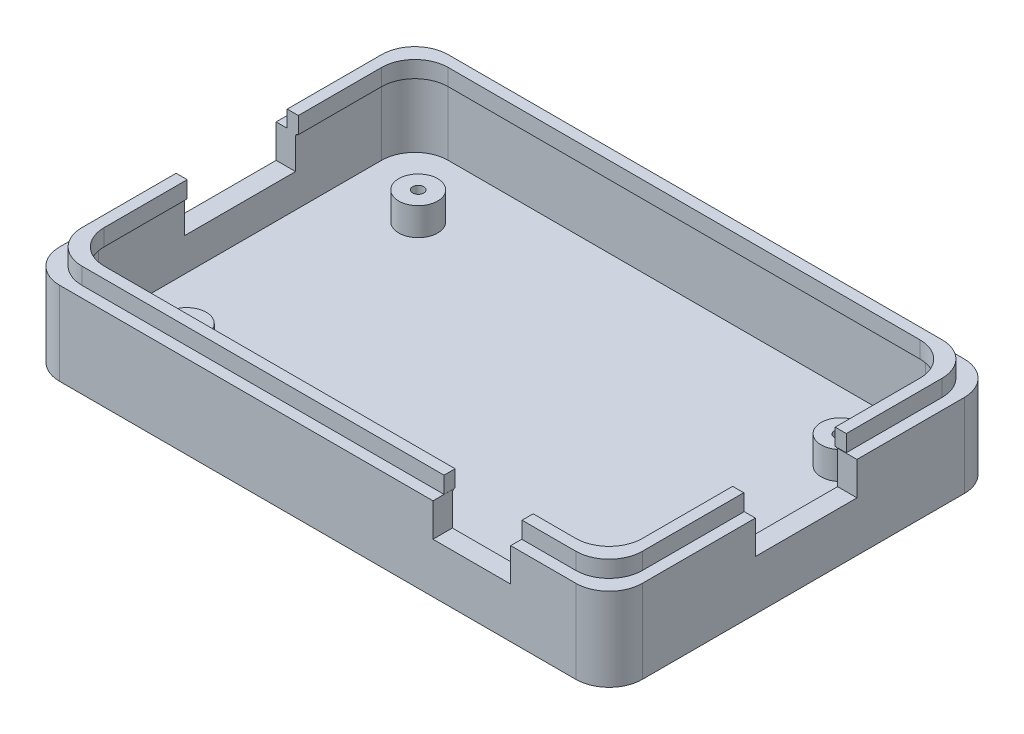
from build123d import *

# Parameters (mm, degrees)
SKETCH1_W           = 105
SKETCH1_H           = 70
BOSS_EXTRUDE1_DEPTH = 15
SKETCH3_W           = 98
SKETCH3_H           = 63
CUT_EXTRUDE1_DEPTH  = 12
FILLET1_R           = 6
SKETCH4_R           = 3.5
BOSS_EXTRUDE2_DEPTH = 5
SKETCH5_R           = 1
CUT_EXTRUDE2_DEPTH  = 8
SKETCH6_W           = 3.5
SKETCH6_H           = 18.3
SKETCH6_W_2         = 14
SKETCH6_H_2         = 3.5
SKETCH6_H_3         = 20
CUT_EXTRUDE3_DEPTH  = 6
BOSS_EXTRUDE3_DEPTH = 3
FILLET2_R           = 0.5


with BuildPart() as part:
    # Sketch1 → Boss-Extrude1 (new body)
    with BuildSketch(Plane(origin=(0, 0, 0), x_dir=(1, 0, 0), z_dir=(0, 1, 0))):
        Rectangle(SKETCH1_W, SKETCH1_H)
    extrude(amount=BOSS_EXTRUDE1_DEPTH)

    # Sketch3 → Cut-Extrude1 (cut)
    with BuildSketch(Plane(origin=(0, 15, 0), x_dir=(1, 0, 0), z_dir=(0, 1, 0))):
        Rectangle(SKETCH3_W, SKETCH3_H)
    extrude(amount=-CUT_EXTRUDE1_DEPTH, mode=Mode.SUBTRACT)

    # Fillet1
    fillet1_edges = [part.edges().sort_by_distance(p)[0] for p in [
        (-49, 9, 31.5),
        (-49, 9, -31.5),
        (49, 9, -31.5),
        (49, 9, 31.5),
        (52.5, 7.5, 35),
        (-52.5, 7.5, 35),
        (-52.5, 7.5, -35),
        (52.5, 7.5, -35),
    ]]
    fillet(fillet1_edges, radius=FILLET1_R)

    # Sketch4 → Boss-Extrude2 (add)
    with BuildSketch(Plane(origin=(0, 3, 0), x_dir=(1, 0, 0), z_dir=(0, 1, 0))):
        with Locations(Location((40, -22.5, 0), (0, 0, 270))):
            Circle(SKETCH4_R)
        with Locations(Location((40, 19.2, 0), (0, 0, 270))):
            Circle(SKETCH4_R)
        with Locations(Location((-36.1, -22.5, 0), (0, 0, 270))):
            Circle(SKETCH4_R)
        with Locations(Location((-36.1, 19.2, 0), (0, 0, 270))):
            Circle(SKETCH4_R)
    extrude(amount=BOSS_EXTRUDE2_DEPTH)

    # Sketch5 → Cut-Extrude2 (cut)
    with BuildSketch(Plane(origin=(0, 8, 0), x_dir=(1, 0, 0), z_dir=(0, 1, 0))):
        with Locations(Location((-36.1, 19.2, 0), (0, 0, 270))):
            Circle(SKETCH5_R)
        with Locations(Location((-36.1, -22.5, 0), (0, 0, 270))):
            Circle(SKETCH5_R)
        with Locations(Location((40, -22.5, 0), (0, 0, 270))):
            Circle(SKETCH5_R)
        with Locations(Location((40, 19.06026255, 0), (0, 0, 270))):
            Circle(SKETCH5_R)
    extrude(amount=-CUT_EXTRUDE2_DEPTH, mode=Mode.SUBTRACT)

    # Sketch6 → Cut-Extrude3 (cut)
    with BuildSketch(Plane(origin=(0, 15, 0), x_dir=(1, 0, 0), z_dir=(0, 1, 0))):
        with Locations((50.75, 0.51)):
            Rectangle(SKETCH6_W, SKETCH6_H)
        with Locations((27.76, -33.25)):
            Rectangle(SKETCH6_W_2, SKETCH6_H_2)
        with Locations((-50.75, 0)):
            Rectangle(SKETCH6_W, SKETCH6_H_3)
    extrude(amount=-CUT_EXTRUDE3_DEPTH, mode=Mode.SUBTRACT)

    # Sketch7 → Boss-Extrude3 (add)
    with BuildSketch(Plane(origin=(0, 15, 0), x_dir=(1, 0, 0), z_dir=(0, 1, 0))):
        with BuildLine():
            Line((-44.5, 33), (44.5, 33))
            ThreePointArc((44.5, 33), (48.742640687, 31.242640687), (50.5, 27))
            Line((50.5, 27), (50.5, 9.736559035))
            Line((50.5, 9.736559035), (48.5, 9.736559035))
            Line((48.5, 9.736559035), (48.5, 25))
            ThreePointArc((48.5, 25), (46.742640687, 29.242640687), (42.5, 31))
            Line((42.5, 31), (-42.5, 31))
            ThreePointArc((-42.5, 31), (-46.742640687, 29.242640687), (-48.5, 25))
            Line((-48.5, 25), (-48.5, 10))
            Line((-48.5, 10), (-50.5, 10))
            Line((-50.5, 10), (-50.5, 27))
            ThreePointArc((-50.5, 27), (-48.742640687, 31.242640687), (-44.5, 33))
        make_face()
        with BuildLine():
            Line((-44.5, -33), (20.754470261, -33))
            Line((20.754470261, -33), (20.754470261, -31))
            Line((20.754470261, -31), (-42.5, -31))
            ThreePointArc((-42.5, -31), (-46.742640687, -29.242640687), (-48.5, -25))
            Line((-48.5, -25), (-48.5, -10.02702289))
            Line((-48.5, -10.02702289), (-50.5, -10.02702289))
            Line((-50.5, -10.02702289), (-50.5, -27))
            ThreePointArc((-50.5, -27), (-48.742640687, -31.242640687), (-44.5, -33))
        make_face()
        with BuildLine():
            Line((50.5, -8.739580153), (50.5, -27))
            ThreePointArc((50.5, -27), (48.742640687, -31.242640687), (44.5, -33))
            Line((44.5, -33), (34.809182833, -33))
            Line((34.809182833, -33), (34.809182833, -31))
            Line((34.809182833, -31), (42.5, -31))
            ThreePointArc((42.5, -31), (46.742640687, -29.242640687), (48.5, -25))
            Line((48.5, -25), (48.5, -8.739580153))
            Line((48.5, -8.739580153), (50.5, -8.739580153))
        make_face()
    extrude(amount=BOSS_EXTRUDE3_DEPTH)

    # Fillet2
    fillet2_edges = [part.edges().sort_by_distance(p)[0] for p in [
        (49, 15, 17.119790077),
        (47.242640687, 15, 29.742640687),
        (-49, 15, 17.763511445),
        (-47.242640687, 15, 29.742640687),
        (49, 15, -17.618279517),
        (47.242640687, 15, -29.742640687),
        (-49, 15, -17.75),
        (-47.242640687, 15, -29.742640687),
        (38.904591417, 15, 31.5),
        (-11.12276487, 15, 31.5),
        (0, 15, -31.5),
    ]]
    fillet(fillet2_edges, radius=FILLET2_R - 0.0001)  # a hair under: the kernel refuses the full size


solid = part.part
